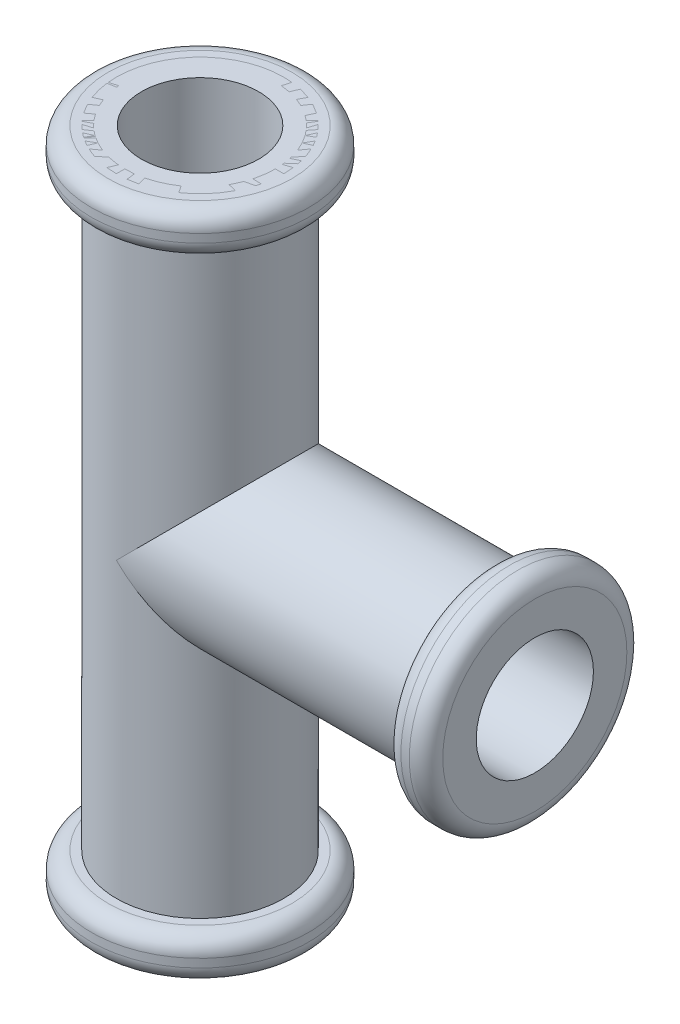
from build123d import *

# Parameters (mm, degrees)
SKETCH_1_R               = 10
EXTRUDE_1_DEPTH          = 40
SHELL_1_T                = -3
EXTRUDE_2_REACH          = 66.807
EXTRUDE_2_END_RADIUS     = 10
SKETCH_2_R               = 10
CUT_EXTRUDE_1_REACH      = 66.807
CUT_EXTRUDE_1_END_RADIUS = 7
SKETCH_3_R               = 7
SKETCH_5_R               = 13
SKETCH_5_R_2             = 9
EXTRUDE_2_2_DEPTH        = 5
SKETCH_6_R               = 13
SKETCH_6_R_2             = 9
EXTRUDE_3_DEPTH          = 5
SKETCH_7_R               = 13
SKETCH_7_R_2             = 9
EXTRUDE_4_DEPTH          = 5
FILLET_1_R               = 2
FILLET_2_R               = 2


with BuildPart() as part:
    # 草图1 → 凸台-拉伸1 (new, symmetric)
    with BuildSketch(Plane(origin=(0, 0, 0), x_dir=(1, 0, 0), z_dir=(0, 1, 0))):
        with Locations(Location((0, 0, 0), (0, 0, 270))):
            Circle(SKETCH_1_R)
    extrude(amount=EXTRUDE_1_DEPTH, both=True)

    # 抽壳1
    shell_1_openings = [part.faces().sort_by_distance(p)[0] for p in [
        (0, 40, 0),
        (0, -40, 0),
    ]]
    offset(amount=SHELL_1_T, openings=shell_1_openings, kind=Kind.INTERSECTION)

    # Extrude 2: up to this cylinder (the profile starts outside it)
    extrude_2_end = Plane(origin=(0, 0, 0), z_dir=(0, -1, 0)) * Cylinder(EXTRUDE_2_END_RADIUS, 154.614, mode=Mode.PRIVATE)
    # 草图2 → Extrude 2 (add, up to the surface)
    with BuildSketch(Plane(origin=(40, 0, 0), x_dir=(0, 0, -1), z_dir=(1, 0, 0)), mode=Mode.PRIVATE) as extrude_2_sk1:
        Circle(SKETCH_2_R)
    extrude_2_tool1 = extrude(extrude_2_sk1.sketch, amount=-EXTRUDE_2_REACH, mode=Mode.PRIVATE) - extrude_2_end
    add(extrude_2_tool1.solids().sort_by_distance((40, 0, 0))[0])

    # 切除-拉伸1: up to this cylinder (the profile starts outside it)
    cut_extrude_1_end = Plane(origin=(0, 0, 0), z_dir=(0, -1, 0)) * Cylinder(CUT_EXTRUDE_1_END_RADIUS, 148.614, mode=Mode.PRIVATE)
    # 草图3 → 切除-拉伸1 (cut, up to the surface)
    with BuildSketch(Plane(origin=(40, 0, 0), x_dir=(0, 0, -1), z_dir=(1, 0, 0)), mode=Mode.PRIVATE) as cut_extrude_1_sk1:
        Circle(SKETCH_3_R)
    cut_extrude_1_tool1 = extrude(cut_extrude_1_sk1.sketch, amount=-CUT_EXTRUDE_1_REACH, mode=Mode.PRIVATE) - cut_extrude_1_end
    add(cut_extrude_1_tool1.solids().sort_by_distance((40, 0, 0))[0], mode=Mode.SUBTRACT)

    # 草图6 → 拉伸-薄壁3 (add)
    with BuildSketch(Plane(origin=(40, 0, 0), x_dir=(0, 0, -1), z_dir=(1, 0, 0))):
        Circle(SKETCH_6_R)
        Circle(SKETCH_6_R_2, mode=Mode.SUBTRACT)
    extrude(amount=-EXTRUDE_3_DEPTH)

    # 草图7 → 拉伸-薄壁4 (add)
    with BuildSketch(Plane.XZ.offset(40)):
        Circle(SKETCH_7_R)
        Circle(SKETCH_7_R_2, mode=Mode.SUBTRACT)
    extrude(amount=-EXTRUDE_4_DEPTH)

    # 圆角1
    fillet_1_edges = [part.edges().sort_by_distance(p)[0] for p in [
        (35, 0, 13),
        (40, 0, 13),
        (-13, -35, 0),
        (-13, -40, 0),
    ]]
    fillet(fillet_1_edges, radius=FILLET_1_R)


with BuildPart() as body_2:
    # 草图5 → Extrude 2 2 (new body)
    with BuildSketch(Plane(origin=(0, 40, 0), x_dir=(1, 0, 0), z_dir=(0, 1, 0))):
        Circle(SKETCH_5_R)
        Circle(SKETCH_5_R_2, mode=Mode.SUBTRACT)
    extrude(amount=-EXTRUDE_2_2_DEPTH)

    # 圆角2
    fillet_2_edges = [body_2.edges().sort_by_distance(p)[0] for p in [
        (-13, 40, 0),
        (-13, 35, 0),
        (-9, 35, 0),
    ]]
    fillet(fillet_2_edges, radius=FILLET_2_R - 0.0001)  # a hair under: the kernel refuses the full size


solid = Compound([part.part, body_2.part])
